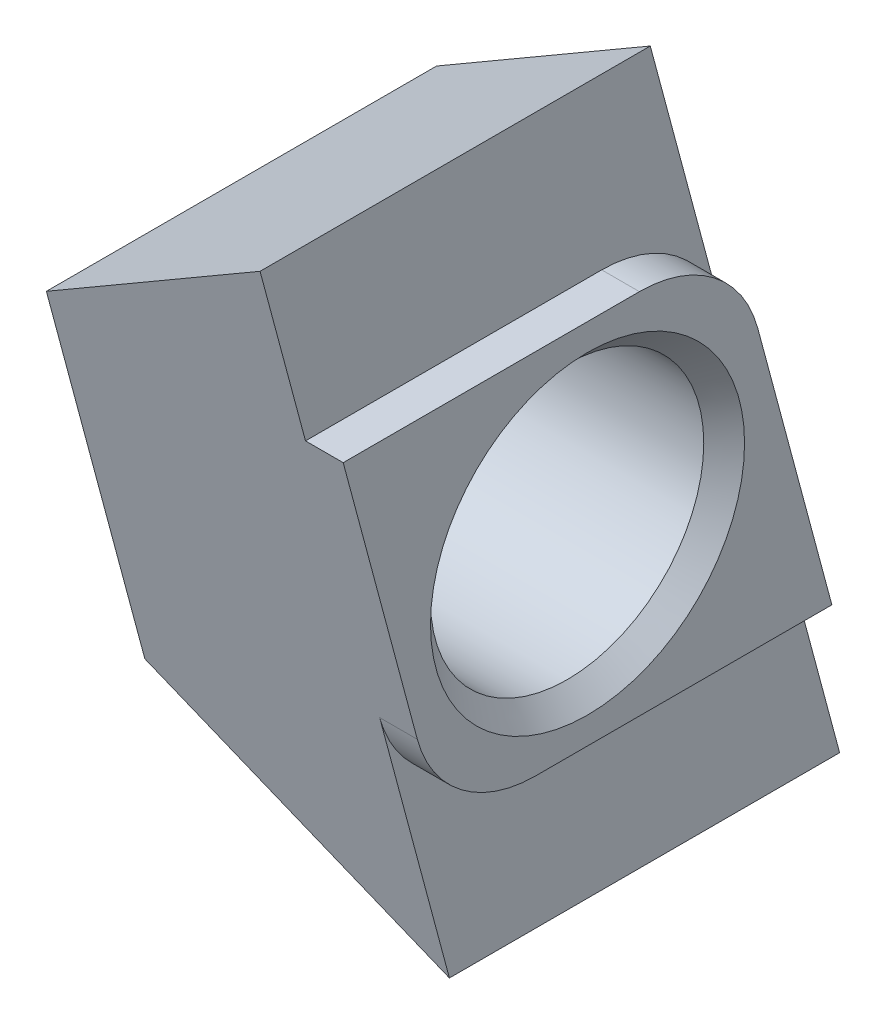
from build123d import *

# Parameters (mm, degrees)
EXTRUDE1_DEPTH       = 0.8
EXTRUDE2_DEPTH       = 5.5
DRAFT1_ANGLE         = -33.206570315
DRAFT2_ANGLE         = -33.206570315
M5_CLEARANCE_HOLE1_D = 5.8
CHAMFER1_SIZE        = 0.433


with BuildPart() as part:
    # Sketch1 → Extrude1 (new body)
    with BuildSketch(Plane(origin=(0, 0, 0), x_dir=(0, 0, -1), z_dir=(1, 0, 0))):
        with BuildLine():
            Line((1.101052702, 3.9), (-5.186106572, 3.9))
            Line((-5.186106572, 3.9), (-3.612459851, -1.972929517))
            ThreePointArc((-3.612459851, -1.972929517), (-2.683832418, -3.362718685), (-1.101052702, -3.9))
            Line((-1.101052702, -3.9), (5.186106572, -3.9))
            Line((5.186106572, -3.9), (3.612459851, 1.972929517))
            ThreePointArc((3.612459851, 1.972929517), (2.683832418, 3.362718685), (1.101052702, 3.9))
        make_face()
    extrude(amount=-EXTRUDE1_DEPTH)

    # Sketch2 → Extrude2 (add)
    with BuildSketch(Plane.ZY.offset(0.8)):
        with BuildLine():
            Line((2.131485778, -7.5), (-6.150723665, -7.5))
            add(Edge.make_bspline(
                [(-2.131485778, 7.5), (-3.471231741, 2.5), (-4.810977703, -2.5), (-6.150723665, -7.5)],
                knots=[0, 0, 0, 0, 1, 1, 1, 1], degree=3))
            Line((-2.131485778, 7.5), (6.150723665, 7.5))
            add(Edge.make_bspline(
                [(2.131485778, -7.5), (3.471231741, -2.5), (4.810977703, 2.5), (6.150723665, 7.5)],
                knots=[0, 0, 0, 0, 1, 1, 1, 1], degree=3))
        make_face()
    extrude(amount=EXTRUDE2_DEPTH)

    # Draft1
    draft1_faces = [part.faces().sort_by_distance(p)[0] for p in [
        (-3.55, 7.5, 2.009618943),
    ]]
    draft(draft1_faces, Plane(origin=(-0.8, 0, 4.141104722), x_dir=(0, 0, 1), z_dir=(1, 0, 0)), DRAFT1_ANGLE)

    # Draft2
    draft2_faces = [part.faces().sort_by_distance(p)[0] for p in [
        (-3.55, -7.5, -2.009618943),
    ]]
    draft(draft2_faces, Plane(origin=(-0.8, 0, 4.141104722), x_dir=(0, 0, 1), z_dir=(1, 0, 0)), DRAFT2_ANGLE)

    # M5 Clearance Hole1 (through all)
    with Locations(Plane.ZY.offset(6.3)):
        with Locations((0, 0)):
            Hole(M5_CLEARANCE_HOLE1_D / 2)

    # Chamfer1
    chamfer1_edges = [part.edges().sort_by_distance(p)[0] for p in [
        (0, 0, 2.9),
        (-6.3, 0, 2.9),
    ]]
    chamfer(chamfer1_edges, length=CHAMFER1_SIZE)


solid = part.part
